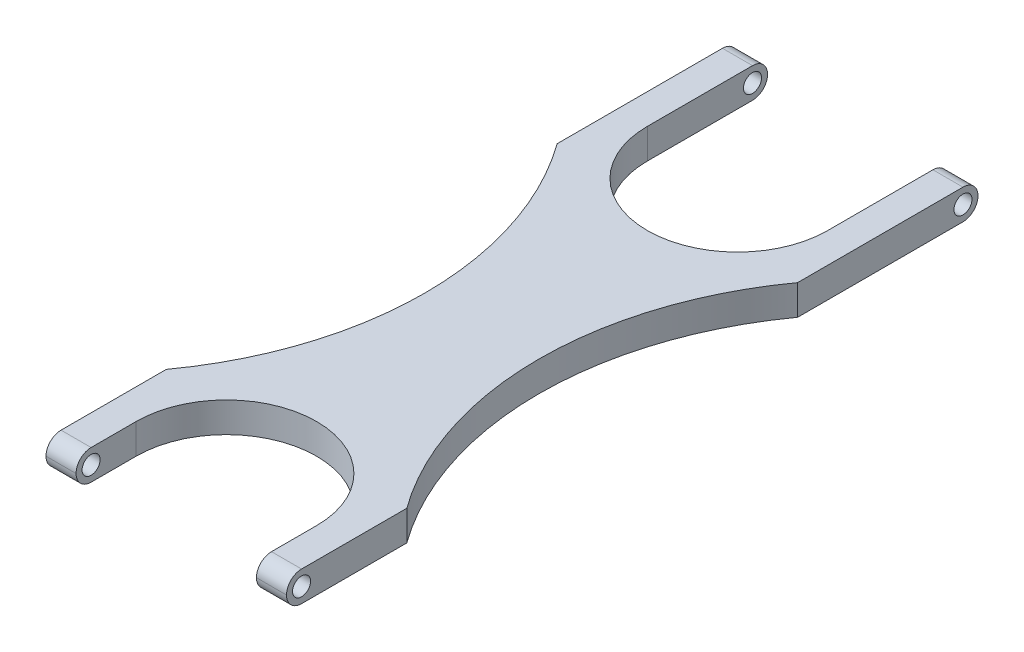
from build123d import *

# Parameters (mm, degrees)
BOSS_EXTRUDE1_DEPTH = 12.7
FILLET1_R           = 6.35
SKETCH2_R           = 3.81
CUT_EXTRUDE1_DEPTH  = 310.525863217
SKETCH3_R           = 3.81
CUT_EXTRUDE2_DEPTH  = 310.525863217


with BuildPart() as part:
    # Sketch1 → Boss-Extrude1 (new body)
    with BuildSketch(Plane(origin=(0, 0, 0), x_dir=(1, 0, 0), z_dir=(0, 1, 0))):
        with BuildLine():
            Line((0, 0), (12.7, 0))
            Line((12.7, 0), (12.7, -50.8))
            ThreePointArc((12.7, -50.8), (23.859231637, -77.740768363), (50.8, -88.9))
            ThreePointArc((50.8, -88.9), (77.740768363, -77.740768363), (88.9, -50.8))
            Line((88.9, -50.8), (88.9, 0))
            Line((88.9, 0), (101.6, 0))
            Line((101.6, 0), (101.6, -76.2))
            ThreePointArc((101.6, -76.2), (74.907118974, -158.75), (101.6, -241.3))
            Line((101.6, -241.3), (101.6, -292.1))
            Line((101.6, -292.1), (88.9, -292.1))
            Line((88.9, -292.1), (88.9, -266.7))
            ThreePointArc((88.9, -266.7), (77.740768363, -239.759231637), (50.8, -228.6))
            ThreePointArc((50.8, -228.6), (23.859231637, -239.759231637), (12.7, -266.7))
            Line((12.7, -266.7), (12.7, -292.1))
            Line((12.7, -292.1), (0, -292.1))
            Line((0, -292.1), (0, -241.3))
            ThreePointArc((0, -241.3), (26.692881026, -158.75), (0, -76.2))
            Line((0, -76.2), (0, 0))
        make_face()
    extrude(amount=BOSS_EXTRUDE1_DEPTH)

    # Fillet1
    fillet1_edges = [part.edges().sort_by_distance(p)[0] for p in [
        (95.25, 0, 0),
        (6.35, 0, 0),
        (95.25, 12.7, 0),
        (6.35, 12.7, 0),
        (6.35, 0, 292.1),
        (6.35, 12.7, 292.1),
        (95.25, 0, 292.1),
        (95.25, 12.7, 292.1),
    ]]
    fillet(fillet1_edges, radius=FILLET1_R - 0.0001)  # a hair under: the kernel refuses the full size

    # Sketch2 → Cut-Extrude1 (cut, through all)
    with BuildSketch(Plane(origin=(101.6, 0, 0), x_dir=(0, 0, -1), z_dir=(1, 0, 0))):
        with Locations((-285.75, 6.35)):
            Circle(SKETCH2_R)
    extrude(amount=-CUT_EXTRUDE1_DEPTH, mode=Mode.SUBTRACT)

    # Sketch3 → Cut-Extrude2 (cut, through all)
    with BuildSketch(Plane(origin=(101.6, 0, 0), x_dir=(0, 0, -1), z_dir=(1, 0, 0))):
        with Locations((-6.35, 6.35)):
            Circle(SKETCH3_R)
    extrude(amount=-CUT_EXTRUDE2_DEPTH, mode=Mode.SUBTRACT)


solid = part.part
